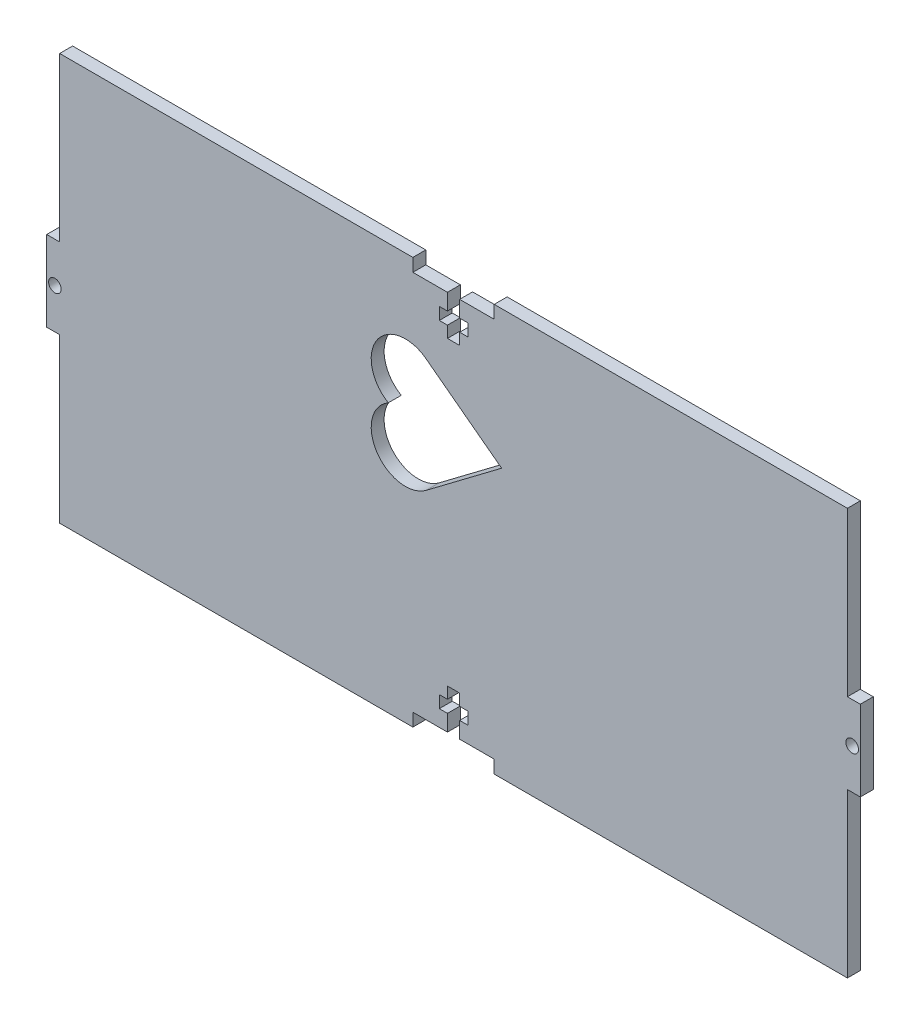
from build123d import *

# Parameters (mm, degrees)
SKETCH1_W           = 200
SKETCH1_H           = 100
BOSS_EXTRUDE2_DEPTH = 3.18
SKETCH2_R           = 1.55
SKETCH2_W           = 3.18
SKETCH2_H           = 40.125
CUT_EXTRUDE1_DEPTH  = 112.84861376
CUT_EXTRUDE2_DEPTH  = 112.84861376


with BuildPart() as part:
    # Sketch1 → Boss-Extrude2 (new body)
    with BuildSketch(Plane.XY):
        Rectangle(SKETCH1_W, SKETCH1_H)
    extrude(amount=BOSS_EXTRUDE2_DEPTH)

    # Sketch2 → Cut-Extrude1 (cut, through all)
    with BuildSketch(Plane.XY.offset(3.18)):
        with Locations((-98, 0)):
            Circle(SKETCH2_R)
        Polygon((-10, 50), (-10, 46.82), (-1.5, 46.82), (-1.5, 42.82), (-3.5, 42.82), (-3.5, 39.82), (-1.5, 39.82), (-1.5, 37), (1.5, 37), (1.5, 39.82), (3.5, 39.82), (3.5, 42.82), (1.5, 42.82), (1.5, 46.82), (10, 46.82), (10, 50), align=None)
        with Locations((-98.41, 29.9375)):
            Rectangle(SKETCH2_W, SKETCH2_H)
        with Locations((-98.41, -29.9375)):
            Rectangle(SKETCH2_W, SKETCH2_H)
    cut_extrude1 = extrude(amount=-CUT_EXTRUDE1_DEPTH, mode=Mode.SUBTRACT)

    # Mirror1: Cut-Extrude1 across plane
    add(cut_extrude1.mirror(Plane.ZX), mode=Mode.SUBTRACT)

    # Mirror2: Cut-Extrude1 across plane
    add(cut_extrude1.mirror(Plane(origin=(0, 0, 0), x_dir=(0, 0, 1), z_dir=(1, 0, 0))), mode=Mode.SUBTRACT)

    # Sketch3 → Cut-Extrude2 (cut, through all)
    with BuildSketch(Plane.XY.offset(3.18)):
        with BuildLine():
            Line((11.820644174, 16.030736619), (-6.758834168, 30.039623174))
            ThreePointArc((-6.758834168, 30.039623174), (-18.842979078, 27.964831158), (-16.030736619, 16.030736619))
            ThreePointArc((-16.030736619, 16.030736619), (-18.842979078, 4.09664208), (-6.758834168, 2.021850064))
            Line((-6.758834168, 2.021850064), (11.820644174, 16.030736619))
        make_face()
    extrude(amount=-CUT_EXTRUDE2_DEPTH, mode=Mode.SUBTRACT)


solid = part.part
